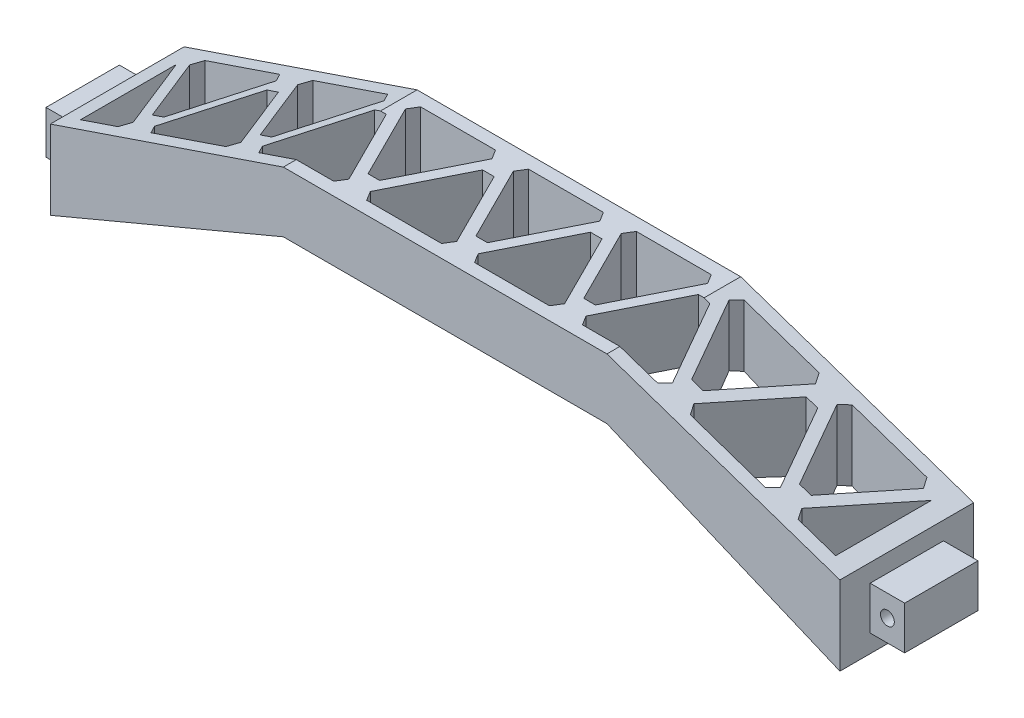
from build123d import *

# Parameters (mm, degrees)
BOSS_EXTRUDE1_DEPTH = 36
CUT_EXTRUDE2_DEPTH  = 100.565305202
BOSS_EXTRUDE4_DEPTH = 31
SKETCH15_W          = 17
SKETCH15_H          = 10
BOSS_EXTRUDE7_DEPTH = 8
SKETCH16_W          = 17
SKETCH16_H          = 10
BOSS_EXTRUDE8_DEPTH = 8
CUT_EXTRUDE7_REACH  = 110.172
SKETCH17_R          = 1.6


with BuildPart() as part:
    # Sketch1 → Boss-Extrude1 (new body)
    with BuildSketch(Plane(origin=(0, 0, 0), x_dir=(1, 0, 0), z_dir=(0, 1, 0))):
        Polygon((87.5, -12.5), (76.397542486, -12.5), (87.5, 9.704915028), (87.5, 15.5), (-87.5, 15.5), (-87.5, 9.704915028), (-76.397542486, -12.5), (-87.5, -12.5), (-87.5, -15.5), (87.5, -15.5), align=None)
        Polygon((-62.5, 9.704915028), (-51.397542486, -12.5), (-73.602457514, -12.5), align=None, mode=Mode.SUBTRACT)
        Polygon((-37.5, 9.704915028), (-26.397542486, -12.5), (-48.602457514, -12.5), align=None, mode=Mode.SUBTRACT)
        Polygon((-1.397542486, -12.5), (-23.602457514, -12.5), (-12.5, 9.704915028), align=None, mode=Mode.SUBTRACT)
        Polygon((23.602457514, -12.5), (1.397542486, -12.5), (12.5, 9.704915028), align=None, mode=Mode.SUBTRACT)
        Polygon((73.602457514, -12.5), (51.397542486, -12.5), (62.5, 9.704915028), align=None, mode=Mode.SUBTRACT)
        Polygon((-86.102457514, 12.5), (-63.897542486, 12.5), (-75, -9.704915028), align=None, mode=Mode.SUBTRACT)
        Polygon((-61.102457514, 12.5), (-38.897542486, 12.5), (-50, -9.704915028), align=None, mode=Mode.SUBTRACT)
        Polygon((-25, -9.704915028), (-36.102457514, 12.5), (-13.897542486, 12.5), align=None, mode=Mode.SUBTRACT)
        Polygon((-11.102457514, 12.5), (11.102457514, 12.5), (0, -9.704915028), align=None, mode=Mode.SUBTRACT)
        Polygon((48.602457514, -12.5), (26.397542486, -12.5), (37.5, 9.704915028), align=None, mode=Mode.SUBTRACT)
        Polygon((13.897542486, 12.5), (36.102457514, 12.5), (25, -9.704915028), align=None, mode=Mode.SUBTRACT)
        Polygon((38.897542486, 12.5), (61.102457514, 12.5), (50, -9.704915028), align=None, mode=Mode.SUBTRACT)
        Polygon((63.897542486, 12.5), (86.102457514, 12.5), (75, -9.704915028), align=None, mode=Mode.SUBTRACT)
    extrude(amount=BOSS_EXTRUDE1_DEPTH)

    # Sketch8 → Cut-Extrude2 (cut, through all)
    with BuildSketch(Plane.XY.offset(15.5)):
        Polygon((-37.5, 21), (-87.5, 0), (87.5, 0), (37.5, 21), align=None)
        Polygon((-87.5, 36), (-87.5, 18), (-37.5, 35), (37.5, 35), (87.5, 18), (87.5, 36), align=None)
    extrude(amount=-CUT_EXTRUDE2_DEPTH, mode=Mode.SUBTRACT)

    # Chamfer4
    # the kernel refuses this chamfer: 1.5 mm, written as the material it adds along each edge
    with BuildSketch(Plane(origin=(-62.5, 2.931728692, -9.704915028), x_dir=(-0.4629989892930077, 0, 0.8863588076584185), z_dir=(0, 1, 0))) as chamfer4_piece_1_section:
        with BuildLine():
            Line((3.027308523, 0), (1.729391988, 2.484713313))
            Line((1.729391988, 2.484713313), (1.70507667, 2.502285032))
            ThreePointArc((1.70507667, 2.502285032), (0.862128958, 1.244211752), (-0.024315318, 0.017571719))
            Line((-0.024315318, 0.017571719), (0.000531815, -0.029995286))
            ThreePointArc((0.000531815, -0.029995286), (1.513710407, -0.003166687), (3.027840338, -0.029995286))
            Line((3.027840338, -0.029995286), (3.027308523, 0))
        make_face()
    chamfer4_piece_1 = extrude(amount=31.136542616, mode=Mode.PRIVATE)
    chamfer4_piece_1 = split(chamfer4_piece_1, bisect_by=Plane(origin=(-59.645483248, 11.698897036, -7.924858459), z_dir=(-0.38723248435509167, 0.9219821056073614, 0)), keep=Keep.TOP, mode=Mode.PRIVATE)
    chamfer4_piece_1 = split(chamfer4_piece_1, bisect_by=Plane(origin=(-64.939848928, 25.670451364, -7.924858459), z_dir=(0.3219027332387023, -0.9467727448197127, 0)), keep=Keep.TOP, mode=Mode.PRIVATE)
    add(chamfer4_piece_1)
    with BuildSketch(Plane(origin=(-73.602457514, -0.310843565, 12.5), x_dir=(0.428553455737718, 0, -0.903516427949852), z_dir=(0, 1, 0))) as chamfer4_piece_2_section:
        with BuildLine():
            Line((2.459124564, 0), (1.0075247, -2.243253797))
            Line((1.0075247, -2.243253797), (0.980419208, -2.256110401))
            ThreePointArc((0.980419208, -2.256110401), (0.499714167, -1.123547022), (-0.027105493, -0.012856604))
            Line((-0.027105493, -0.012856604), (0.000622649, 0.029993538))
            ThreePointArc((0.000622649, 0.029993538), (1.229655274, 0.004479511), (2.459747213, 0.029993538))
            Line((2.459747213, 0.029993538), (2.459124564, 0))
        make_face()
    chamfer4_piece_2 = extrude(amount=29.18381942, mode=Mode.PRIVATE)
    chamfer4_piece_2 = split(chamfer4_piece_2, bisect_by=Plane(origin=(-69.441653139, 7.584505682, 11.78052019), z_dir=(-0.38723248435509167, 0.9219821056073614, 0)), keep=Keep.TOP, mode=Mode.PRIVATE)
    chamfer4_piece_2 = split(chamfer4_piece_2, bisect_by=Plane(origin=(-74.99909614, 22.250307312, 11.78052019), z_dir=(0.3219027332387023, -0.9467727448197127, 0)), keep=Keep.TOP, mode=Mode.PRIVATE)
    add(chamfer4_piece_2)
    with BuildSketch(Plane(origin=(-25, 21, 9.704915028), x_dir=(-0.4629989892930077, 0, -0.8863588076584186), z_dir=(0, 1, 0)), Plane(origin=(12.5, 21, -9.704915028), x_dir=(0.4629989892930091, 0, 0.8863588076584178), z_dir=(0, 1, 0)), Plane(origin=(0, 21, 9.704915028), x_dir=(-0.462998989293008, 0, -0.8863588076584183), z_dir=(0, 1, 0))) as chamfer4_piece_3:
        with BuildLine():
            Line((3.027308523, 0), (1.729391988, -2.484713313))
            Line((1.729391988, -2.484713313), (1.70507667, -2.502285032))
            ThreePointArc((1.70507667, -2.502285032), (0.862128958, -1.244211752), (-0.024315318, -0.017571719))
            Line((-0.024315318, -0.017571719), (0.000531815, 0.029995286))
            ThreePointArc((0.000531815, 0.029995286), (1.513710407, 0.003166687), (3.027840338, 0.029995286))
            Line((3.027840338, 0.029995286), (3.027308523, 0))
        make_face()
    extrude(amount=14)
    with BuildSketch(Plane(origin=(-13.897542486, 21, -12.5), x_dir=(-0.9997845924778608, 0, -0.02075496672793586), z_dir=(0, 1, 0)), Plane(origin=(23.602457514, 21, 12.5), x_dir=(-0.4285534557377203, 0, -0.9035164279498509), z_dir=(0, 1, 0)), Plane(origin=(-11.102457514, 21, -12.5), x_dir=(0.42855345573771825, 0, 0.9035164279498517), z_dir=(0, 1, 0))) as chamfer4_piece_4:
        with BuildLine():
            Line((2.459124564, 0), (1.0075247, 2.243253797))
            Line((1.0075247, 2.243253797), (0.980419208, 2.256110401))
            ThreePointArc((0.980419208, 2.256110401), (0.499714167, 1.123547022), (-0.027105493, 0.012856604))
            Line((-0.027105493, 0.012856604), (0.000622649, -0.029993538))
            ThreePointArc((0.000622649, -0.029993538), (1.229655274, -0.004479511), (2.459747213, -0.029993538))
            Line((2.459747213, -0.029993538), (2.459124564, 0))
        make_face()
    extrude(amount=14)
    with BuildSketch(Plane(origin=(-50, 8.181728692, 9.704915028), x_dir=(-0.46299898929300837, 0, -0.8863588076584181), z_dir=(0, 1, 0))) as chamfer4_piece_5_section:
        with BuildLine():
            Line((3.027308523, 0), (1.729391988, -2.484713313))
            Line((1.729391988, -2.484713313), (1.70507667, -2.502285032))
            ThreePointArc((1.70507667, -2.502285032), (0.862128958, -1.244211752), (-0.024315318, -0.017571719))
            Line((-0.024315318, -0.017571719), (0.000531815, 0.029995286))
            ThreePointArc((0.000531815, 0.029995286), (1.513710407, 0.003166687), (3.027840338, 0.029995286))
            Line((3.027840338, 0.029995286), (3.027308523, 0))
        make_face()
    chamfer4_piece_5 = extrude(amount=30.136542616, mode=Mode.PRIVATE)
    chamfer4_piece_5 = split(chamfer4_piece_5, bisect_by=Plane(origin=(-47.324104267, 16.873876208, 7.924858459), z_dir=(-0.38723248435509167, 0.9219821056073614, 0)), keep=Keep.TOP, mode=Mode.PRIVATE)
    chamfer4_piece_5 = split(chamfer4_piece_5, bisect_by=Plane(origin=(-52.287577831, 29.972223537, 7.924858459), z_dir=(0.3219027332387023, -0.9467727448197127, 0)), keep=Keep.TOP, mode=Mode.PRIVATE)
    add(chamfer4_piece_5)
    with BuildSketch(Plane(origin=(-38.897542486, 14.265220746, -12.5), x_dir=(-0.428553455737718, 0, 0.903516427949852), z_dir=(0, 1, 0))) as chamfer4_piece_6_section:
        with BuildLine():
            Line((2.459124564, 0), (1.0075247, -2.243253797))
            Line((1.0075247, -2.243253797), (0.980419208, -2.256110401))
            ThreePointArc((0.980419208, -2.256110401), (0.499714167, -1.123547022), (-0.027105493, -0.012856604))
            Line((-0.027105493, -0.012856604), (0.000622649, 0.029993538))
            ThreePointArc((0.000622649, 0.029993538), (1.229655274, 0.004479511), (2.459747213, 0.029993538))
            Line((2.459747213, 0.029993538), (2.459124564, 0))
        make_face()
    chamfer4_piece_6 = extrude(amount=26.407426218, mode=Mode.PRIVATE)
    chamfer4_piece_6 = split(chamfer4_piece_6, bisect_by=Plane(origin=(-37.52721047, 20.988571603, -11.780796898), z_dir=(-0.38723248435509167, 0.9219821056073614, 0)), keep=Keep.TOP, mode=Mode.PRIVATE)
    chamfer4_piece_6 = split(chamfer4_piece_6, bisect_by=Plane(origin=(-42.227587272, 33.392620327, -11.780796898), z_dir=(0.3219027332387023, -0.9467727448197127, 0)), keep=Keep.TOP, mode=Mode.PRIVATE)
    add(chamfer4_piece_6)
    with BuildSketch(Plane(origin=(73.602457514, -0.310843565, 12.5), x_dir=(-0.9997845924778608, 0, 0.02075496672793586), z_dir=(0, 1, 0))) as chamfer4_piece_7_section:
        with BuildLine():
            Line((2.459124564, 0), (1.0075247, -2.243253797))
            Line((1.0075247, -2.243253797), (0.980419208, -2.256110401))
            ThreePointArc((0.980419208, -2.256110401), (0.499714167, -1.123547022), (-0.027105493, -0.012856604))
            Line((-0.027105493, -0.012856604), (0.000622649, 0.029993538))
            ThreePointArc((0.000622649, 0.029993538), (1.229655274, 0.004479511), (2.459747213, 0.029993538))
            Line((2.459747213, 0.029993538), (2.459124564, 0))
        make_face()
    chamfer4_piece_7 = extrude(amount=29.18381942, mode=Mode.PRIVATE)
    chamfer4_piece_7 = split(chamfer4_piece_7, bisect_by=Plane(origin=(69.441653139, 7.584505682, 11.78052019), z_dir=(0.38723248435509167, 0.9219821056073614, 0)), keep=Keep.TOP, mode=Mode.PRIVATE)
    chamfer4_piece_7 = split(chamfer4_piece_7, bisect_by=Plane(origin=(74.99909614, 22.250307312, 11.78052019), z_dir=(-0.3219027332387023, -0.9467727448197127, 0)), keep=Keep.TOP, mode=Mode.PRIVATE)
    add(chamfer4_piece_7)
    with BuildSketch(Plane(origin=(62.5, 2.931728692, -9.704915028), x_dir=(-0.46299898929301003, 0, 0.8863588076584172), z_dir=(0, 1, 0))) as chamfer4_piece_8_section:
        with BuildLine():
            Line((3.027308523, 0), (1.729391988, 2.484713313))
            Line((1.729391988, 2.484713313), (1.70507667, 2.502285032))
            ThreePointArc((1.70507667, 2.502285032), (0.862128958, 1.244211752), (-0.024315318, 0.017571719))
            Line((-0.024315318, 0.017571719), (0.000531815, -0.029995286))
            ThreePointArc((0.000531815, -0.029995286), (1.513710407, -0.003166687), (3.027840338, -0.029995286))
            Line((3.027840338, -0.029995286), (3.027308523, 0))
        make_face()
    chamfer4_piece_8 = extrude(amount=31.136542616, mode=Mode.PRIVATE)
    chamfer4_piece_8 = split(chamfer4_piece_8, bisect_by=Plane(origin=(59.645483248, 11.698897036, -7.924858459), z_dir=(0.38723248435509167, 0.9219821056073614, 0)), keep=Keep.TOP, mode=Mode.PRIVATE)
    chamfer4_piece_8 = split(chamfer4_piece_8, bisect_by=Plane(origin=(64.939848928, 25.670451364, -7.924858459), z_dir=(-0.3219027332387023, -0.9467727448197127, 0)), keep=Keep.TOP, mode=Mode.PRIVATE)
    add(chamfer4_piece_8)
    with BuildSketch(Plane(origin=(48.602457514, 10.189156435, 12.5), x_dir=(-0.9997845924778608, 0, 0.02075496672793586), z_dir=(0, 1, 0))) as chamfer4_piece_9_section:
        with BuildLine():
            Line((2.459124564, 0), (1.0075247, -2.243253797))
            Line((1.0075247, -2.243253797), (0.980419208, -2.256110401))
            ThreePointArc((0.980419208, -2.256110401), (0.499714167, -1.123547022), (-0.027105493, -0.012856604))
            Line((-0.027105493, -0.012856604), (0.000622649, 0.029993538))
            ThreePointArc((0.000622649, 0.029993538), (1.229655274, 0.004479511), (2.459747213, 0.029993538))
            Line((2.459747213, 0.029993538), (2.459124564, 0))
        make_face()
    chamfer4_piece_9 = extrude(amount=27.18381942, mode=Mode.PRIVATE)
    chamfer4_piece_9 = split(chamfer4_piece_9, bisect_by=Plane(origin=(44.798841535, 17.934486555, 11.78050305), z_dir=(0.38723248435509167, 0.9219821056073614, 0)), keep=Keep.TOP, mode=Mode.PRIVATE)
    chamfer4_piece_9 = split(chamfer4_piece_9, bisect_by=Plane(origin=(49.694498865, 30.853870386, 11.78050305), z_dir=(-0.3219027332387023, -0.9467727448197127, 0)), keep=Keep.TOP, mode=Mode.PRIVATE)
    add(chamfer4_piece_9)
    with BuildSketch(Plane(origin=(37.5, 13.431728692, -9.704915028), x_dir=(-0.46299898929300864, 0, 0.886358807658418), z_dir=(0, 1, 0))) as chamfer4_piece_10_section:
        with BuildLine():
            Line((3.027308523, 0), (1.729391988, 2.484713313))
            Line((1.729391988, 2.484713313), (1.70507667, 2.502285032))
            ThreePointArc((1.70507667, 2.502285032), (0.862128958, 1.244211752), (-0.024315318, 0.017571719))
            Line((-0.024315318, 0.017571719), (0.000531815, -0.029995286))
            ThreePointArc((0.000531815, -0.029995286), (1.513710407, -0.003166687), (3.027840338, -0.029995286))
            Line((3.027840338, -0.029995286), (3.027308523, 0))
        make_face()
    chamfer4_piece_10 = extrude(amount=21.568271308, mode=Mode.PRIVATE)
    chamfer4_piece_10 = split(chamfer4_piece_10, bisect_by=Plane(origin=(38.21159426, 21, -7.691631439), z_dir=(0, -1, 0)), keep=Keep.TOP, mode=Mode.PRIVATE)
    chamfer4_piece_10 = split(chamfer4_piece_10, bisect_by=Plane(origin=(38.158242837, 20.723538008, -7.691631439), z_dir=(0.38723248435509167, 0.9219821056073614, 0)), keep=Keep.TOP, mode=Mode.PRIVATE)
    add(chamfer4_piece_10)
    with BuildSketch(Plane(origin=(37.5, 21, -9.704915028), x_dir=(-0.4629989892930089, 0, 0.886358807658418), z_dir=(0, 1, 0))) as chamfer4_piece_11_section:
        with BuildLine():
            Line((3.027308523, 0), (1.729391988, 2.484713313))
            Line((1.729391988, 2.484713313), (1.70507667, 2.502285032))
            ThreePointArc((1.70507667, 2.502285032), (0.862128958, 1.244211752), (-0.024315318, 0.017571719))
            Line((-0.024315318, 0.017571719), (0.000531815, -0.029995286))
            ThreePointArc((0.000531815, -0.029995286), (1.513710407, -0.003166687), (3.027840338, -0.029995286))
            Line((3.027840338, -0.029995286), (3.027308523, 0))
        make_face()
    chamfer4_piece_11 = extrude(amount=14, mode=Mode.PRIVATE)
    chamfer4_piece_11 = split(chamfer4_piece_11, bisect_by=Plane(origin=(36.841757163, 21.276461992, -7.691631439), z_dir=(-0.38723248435509167, -0.9219821056073614, 0)), keep=Keep.TOP, mode=Mode.PRIVATE)
    add(chamfer4_piece_11)
    with BuildSketch(Plane(origin=(37.5, 21, -9.704915028), x_dir=(-0.4629989892930089, 0, 0.886358807658418), z_dir=(0, 1, 0))) as chamfer4_piece_12_section:
        with BuildLine():
            Line((3.027308523, 0), (1.729391988, 2.484713313))
            Line((1.729391988, 2.484713313), (1.70507667, 2.502285032))
            ThreePointArc((1.70507667, 2.502285032), (0.862128958, 1.244211752), (-0.024315318, 0.017571719))
            Line((-0.024315318, 0.017571719), (0.000531815, -0.029995286))
            ThreePointArc((0.000531815, -0.029995286), (1.513710407, -0.003166687), (3.027840338, -0.029995286))
            Line((3.027840338, -0.029995286), (3.027308523, 0))
        make_face()
    chamfer4_piece_12 = extrude(amount=14, mode=Mode.PRIVATE)
    chamfer4_piece_12 = split(chamfer4_piece_12, bisect_by=Plane(origin=(34.998395382, 22.05067394, -7.927883797), z_dir=(0.38723248435509167, 0.9219821056073614, 0)), keep=Keep.TOP, mode=Mode.PRIVATE)
    chamfer4_piece_12 = split(chamfer4_piece_12, bisect_by=Plane(origin=(39.631451626, 34.275306447, -7.927883797), z_dir=(-0.3219027332387023, -0.9467727448197127, 0)), keep=Keep.TOP, mode=Mode.PRIVATE)
    add(chamfer4_piece_12)
    with BuildSketch(Plane(origin=(-1.397542486, 21, 12.5), x_dir=(-0.9997845924778608, 0, 0.02075496672793731), z_dir=(0, 1, 0)), Plane(origin=(-26.397542486, 21, 12.5), x_dir=(-0.999784592477861, 0, 0.020754966727934417), z_dir=(0, 1, 0)), Plane(origin=(36.102457514, 21, -12.5), x_dir=(-0.42855345573771875, 0, 0.9035164279498514), z_dir=(0, 1, 0)), Plane(origin=(11.102457514, 21, -12.5), x_dir=(-0.4285534557377206, 0, 0.9035164279498505), z_dir=(0, 1, 0)), Plane(origin=(-36.102457514, 21, -12.5), x_dir=(0.9997845924778608, 0, -0.02075496672793586), z_dir=(0, 1, 0)), Plane(origin=(26.397542486, 21, 12.5), x_dir=(0.4285534557377188, 0, -0.9035164279498513), z_dir=(0, 1, 0)), Plane(origin=(1.397542486, 21, 12.5), x_dir=(0.4285534557377207, 0, -0.9035164279498505), z_dir=(0, 1, 0)), Plane(origin=(-23.602457514, 21, 12.5), x_dir=(0.42855345573772036, 0, -0.9035164279498508), z_dir=(0, 1, 0)), Plane(origin=(13.897542486, 21, -12.5), x_dir=(0.9997845924778608, 0, -0.02075496672793586), z_dir=(0, 1, 0))) as chamfer4_piece_13:
        with BuildLine():
            Line((2.459124564, 0), (1.0075247, -2.243253797))
            Line((1.0075247, -2.243253797), (0.980419208, -2.256110401))
            ThreePointArc((0.980419208, -2.256110401), (0.499714167, -1.123547022), (-0.027105493, -0.012856604))
            Line((-0.027105493, -0.012856604), (0.000622649, 0.029993538))
            ThreePointArc((0.000622649, 0.029993538), (1.229655274, 0.004479511), (2.459747213, 0.029993538))
            Line((2.459747213, 0.029993538), (2.459124564, 0))
        make_face()
    extrude(amount=14)
    with BuildSketch(Plane(origin=(-12.5, 21, -9.704915028), x_dir=(-0.4629989892930082, 0, 0.8863588076584183), z_dir=(0, 1, 0)), Plane(origin=(25, 21, 9.704915028), x_dir=(0.4629989892930075, 0, -0.8863588076584187), z_dir=(0, 1, 0))) as chamfer4_piece_14:
        with BuildLine():
            Line((3.027308523, 0), (1.729391988, 2.484713313))
            Line((1.729391988, 2.484713313), (1.70507667, 2.502285032))
            ThreePointArc((1.70507667, 2.502285032), (0.862128958, 1.244211752), (-0.024315318, 0.017571719))
            Line((-0.024315318, 0.017571719), (0.000531815, -0.029995286))
            ThreePointArc((0.000531815, -0.029995286), (1.513710407, -0.003166687), (3.027840338, -0.029995286))
            Line((3.027840338, -0.029995286), (3.027308523, 0))
        make_face()
    extrude(amount=14)
    with BuildSketch(Plane(origin=(-37.5, 21, -9.704915028), x_dir=(-0.4629989892930091, 0, 0.8863588076584178), z_dir=(0, 1, 0))) as chamfer4_piece_15_section:
        with BuildLine():
            Line((3.027308523, 0), (1.729391988, 2.484713313))
            Line((1.729391988, 2.484713313), (1.70507667, 2.502285032))
            ThreePointArc((1.70507667, 2.502285032), (0.862128958, 1.244211752), (-0.024315318, 0.017571719))
            Line((-0.024315318, 0.017571719), (0.000531815, -0.029995286))
            ThreePointArc((0.000531815, -0.029995286), (1.513710407, -0.003166687), (3.027840338, -0.029995286))
            Line((3.027840338, -0.029995286), (3.027308523, 0))
        make_face()
    chamfer4_piece_15 = extrude(amount=14, mode=Mode.PRIVATE)
    chamfer4_piece_15 = split(chamfer4_piece_15, bisect_by=Plane(origin=(-36.841757163, 21.276461992, -7.691631439), z_dir=(0.38723248435509167, -0.9219821056073614, 0)), keep=Keep.TOP, mode=Mode.PRIVATE)
    add(chamfer4_piece_15)
    with BuildSketch(Plane(origin=(-37.5, 13.431728692, -9.704915028), x_dir=(-0.4629989892930091, 0, 0.8863588076584178), z_dir=(0, 1, 0))) as chamfer4_piece_16_section:
        with BuildLine():
            Line((3.027308523, 0), (1.729391988, 2.484713313))
            Line((1.729391988, 2.484713313), (1.70507667, 2.502285032))
            ThreePointArc((1.70507667, 2.502285032), (0.862128958, 1.244211752), (-0.024315318, 0.017571719))
            Line((-0.024315318, 0.017571719), (0.000531815, -0.029995286))
            ThreePointArc((0.000531815, -0.029995286), (1.513710407, -0.003166687), (3.027840338, -0.029995286))
            Line((3.027840338, -0.029995286), (3.027308523, 0))
        make_face()
    chamfer4_piece_16 = extrude(amount=21.568271308, mode=Mode.PRIVATE)
    chamfer4_piece_16 = split(chamfer4_piece_16, bisect_by=Plane(origin=(-38.158242837, 20.723538008, -7.691631439), z_dir=(-0.38723248435509167, 0.9219821056073614, 0)), keep=Keep.TOP, mode=Mode.PRIVATE)
    chamfer4_piece_16 = split(chamfer4_piece_16, bisect_by=Plane(origin=(-38.21159426, 21, -7.691631439), z_dir=(0, -1, 0)), keep=Keep.TOP, mode=Mode.PRIVATE)
    add(chamfer4_piece_16)
    with BuildSketch(Plane(origin=(-37.5, 21, -9.704915028), x_dir=(-0.4629989892930091, 0, 0.8863588076584178), z_dir=(0, 1, 0))) as chamfer4_piece_17_section:
        with BuildLine():
            Line((3.027308523, 0), (1.729391988, 2.484713313))
            Line((1.729391988, 2.484713313), (1.70507667, 2.502285032))
            ThreePointArc((1.70507667, 2.502285032), (0.862128958, 1.244211752), (-0.024315318, 0.017571719))
            Line((-0.024315318, 0.017571719), (0.000531815, -0.029995286))
            ThreePointArc((0.000531815, -0.029995286), (1.513710407, -0.003166687), (3.027840338, -0.029995286))
            Line((3.027840338, -0.029995286), (3.027308523, 0))
        make_face()
    chamfer4_piece_17 = extrude(amount=14, mode=Mode.PRIVATE)
    chamfer4_piece_17 = split(chamfer4_piece_17, bisect_by=Plane(origin=(-34.998395382, 22.05067394, -7.927883797), z_dir=(-0.38723248435509167, 0.9219821056073614, 0)), keep=Keep.TOP, mode=Mode.PRIVATE)
    chamfer4_piece_17 = split(chamfer4_piece_17, bisect_by=Plane(origin=(-39.631451626, 34.275306447, -7.927883797), z_dir=(0.3219027332387023, -0.9467727448197127, 0)), keep=Keep.TOP, mode=Mode.PRIVATE)
    add(chamfer4_piece_17)
    with BuildSketch(Plane(origin=(75, -2.318271308, 9.704915028), x_dir=(0.46299898929300726, 0, -0.8863588076584187), z_dir=(0, 1, 0))) as chamfer4_piece_18_section:
        with BuildLine():
            Line((3.027308523, 0), (1.729391988, 2.484713313))
            Line((1.729391988, 2.484713313), (1.70507667, 2.502285032))
            ThreePointArc((1.70507667, 2.502285032), (0.862128958, 1.244211752), (-0.024315318, 0.017571719))
            Line((-0.024315318, 0.017571719), (0.000531815, -0.029995286))
            ThreePointArc((0.000531815, -0.029995286), (1.513710407, -0.003166687), (3.027840338, -0.029995286))
            Line((3.027840338, -0.029995286), (3.027308523, 0))
        make_face()
    chamfer4_piece_18 = extrude(amount=32.136542616, mode=Mode.PRIVATE)
    chamfer4_piece_18 = split(chamfer4_piece_18, bisect_by=Plane(origin=(71.966875207, 6.523912413, 7.924858459), z_dir=(0.38723248435509167, 0.9219821056073614, 0)), keep=Keep.TOP, mode=Mode.PRIVATE)
    chamfer4_piece_18 = split(chamfer4_piece_18, bisect_by=Plane(origin=(77.592133351, 21.368674661, 7.924858459), z_dir=(-0.3219027332387023, -0.9467727448197127, 0)), keep=Keep.TOP, mode=Mode.PRIVATE)
    add(chamfer4_piece_18)
    with BuildSketch(Plane(origin=(86.102457514, -5.560843565, -12.5), x_dir=(-0.42855345573771825, 0, 0.9035164279498517), z_dir=(0, 1, 0))) as chamfer4_piece_19_section:
        with BuildLine():
            Line((2.459124564, 0), (1.0075247, -2.243253797))
            Line((1.0075247, -2.243253797), (0.980419208, -2.256110401))
            ThreePointArc((0.980419208, -2.256110401), (0.499714167, -1.123547022), (-0.027105493, -0.012856604))
            Line((-0.027105493, -0.012856604), (0.000622649, 0.029993538))
            ThreePointArc((0.000622649, 0.029993538), (1.229655274, 0.004479511), (2.459747213, 0.029993538))
            Line((2.459747213, 0.029993538), (2.459124564, 0))
        make_face()
    chamfer4_piece_19 = extrude(amount=30.18381942, mode=Mode.PRIVATE)
    chamfer4_piece_19 = split(chamfer4_piece_19, bisect_by=Plane(origin=(81.763073015, 2.409509334, -11.780527316), z_dir=(0.38723248435509167, 0.9219821056073614, 0)), keep=Keep.TOP, mode=Mode.PRIVATE)
    chamfer4_piece_19 = split(chamfer4_piece_19, bisect_by=Plane(origin=(87.65140923, 17.948520862, -11.780527316), z_dir=(-0.3219027332387023, -0.9467727448197127, 0)), keep=Keep.TOP, mode=Mode.PRIVATE)
    add(chamfer4_piece_19)
    with BuildSketch(Plane(origin=(50, 8.181728692, 9.704915028), x_dir=(0.46299898929300953, 0, -0.8863588076584177), z_dir=(0, 1, 0))) as chamfer4_piece_20_section:
        with BuildLine():
            Line((3.027308523, 0), (1.729391988, 2.484713313))
            Line((1.729391988, 2.484713313), (1.70507667, 2.502285032))
            ThreePointArc((1.70507667, 2.502285032), (0.862128958, 1.244211752), (-0.024315318, 0.017571719))
            Line((-0.024315318, 0.017571719), (0.000531815, -0.029995286))
            ThreePointArc((0.000531815, -0.029995286), (1.513710407, -0.003166687), (3.027840338, -0.029995286))
            Line((3.027840338, -0.029995286), (3.027308523, 0))
        make_face()
    chamfer4_piece_20 = extrude(amount=30.136542616, mode=Mode.PRIVATE)
    chamfer4_piece_20 = split(chamfer4_piece_20, bisect_by=Plane(origin=(47.324104267, 16.873876208, 7.924858459), z_dir=(0.38723248435509167, 0.9219821056073614, 0)), keep=Keep.TOP, mode=Mode.PRIVATE)
    chamfer4_piece_20 = split(chamfer4_piece_20, bisect_by=Plane(origin=(52.287577831, 29.972223537, 7.924858459), z_dir=(-0.3219027332387023, -0.9467727448197127, 0)), keep=Keep.TOP, mode=Mode.PRIVATE)
    add(chamfer4_piece_20)
    with BuildSketch(Plane(origin=(61.102457514, 4.939156435, -12.5), x_dir=(-0.42855345573772, 0, 0.9035164279498509), z_dir=(0, 1, 0))) as chamfer4_piece_21_section:
        with BuildLine():
            Line((2.459124564, 0), (1.0075247, -2.243253797))
            Line((1.0075247, -2.243253797), (0.980419208, -2.256110401))
            ThreePointArc((0.980419208, -2.256110401), (0.499714167, -1.123547022), (-0.027105493, -0.012856604))
            Line((-0.027105493, -0.012856604), (0.000622649, 0.029993538))
            ThreePointArc((0.000622649, 0.029993538), (1.229655274, 0.004479511), (2.459747213, 0.029993538))
            Line((2.459747213, 0.029993538), (2.459124564, 0))
        make_face()
    chamfer4_piece_21 = extrude(amount=28.18381942, mode=Mode.PRIVATE)
    chamfer4_piece_21 = split(chamfer4_piece_21, bisect_by=Plane(origin=(57.120242051, 12.759498339, -11.780512163), z_dir=(0.38723248435509167, 0.9219821056073614, 0)), keep=Keep.TOP, mode=Mode.PRIVATE)
    chamfer4_piece_21 = split(chamfer4_piece_21, bisect_by=Plane(origin=(62.346792075, 26.552090695, -11.780512163), z_dir=(-0.3219027332387023, -0.9467727448197127, 0)), keep=Keep.TOP, mode=Mode.PRIVATE)
    add(chamfer4_piece_21)
    with BuildSketch(Plane(origin=(-75, -2.318271308, 9.704915028), x_dir=(-0.46299898929301, 0, -0.8863588076584172), z_dir=(0, 1, 0))) as chamfer4_piece_22_section:
        with BuildLine():
            Line((3.027308523, 0), (1.729391988, -2.484713313))
            Line((1.729391988, -2.484713313), (1.70507667, -2.502285032))
            ThreePointArc((1.70507667, -2.502285032), (0.862128958, -1.244211752), (-0.024315318, -0.017571719))
            Line((-0.024315318, -0.017571719), (0.000531815, 0.029995286))
            ThreePointArc((0.000531815, 0.029995286), (1.513710407, 0.003166687), (3.027840338, 0.029995286))
            Line((3.027840338, 0.029995286), (3.027308523, 0))
        make_face()
    chamfer4_piece_22 = extrude(amount=32.136542616, mode=Mode.PRIVATE)
    chamfer4_piece_22 = split(chamfer4_piece_22, bisect_by=Plane(origin=(-71.966875207, 6.523912413, 7.924858459), z_dir=(-0.38723248435509167, 0.9219821056073614, 0)), keep=Keep.TOP, mode=Mode.PRIVATE)
    chamfer4_piece_22 = split(chamfer4_piece_22, bisect_by=Plane(origin=(-77.592133351, 21.368674661, 7.924858459), z_dir=(0.3219027332387023, -0.9467727448197127, 0)), keep=Keep.TOP, mode=Mode.PRIVATE)
    add(chamfer4_piece_22)
    with BuildSketch(Plane(origin=(-63.897542486, 3.765220746, -12.5), x_dir=(-0.428553455737718, 0, 0.903516427949852), z_dir=(0, 1, 0))) as chamfer4_piece_23_section:
        with BuildLine():
            Line((2.459124564, 0), (1.0075247, -2.243253797))
            Line((1.0075247, -2.243253797), (0.980419208, -2.256110401))
            ThreePointArc((0.980419208, -2.256110401), (0.499714167, -1.123547022), (-0.027105493, -0.012856604))
            Line((-0.027105493, -0.012856604), (0.000622649, 0.029993538))
            ThreePointArc((0.000622649, 0.029993538), (1.229655274, 0.004479511), (2.459747213, 0.029993538))
            Line((2.459747213, 0.029993538), (2.459124564, 0))
        make_face()
    chamfer4_piece_23 = extrude(amount=28.407426218, mode=Mode.PRIVATE)
    chamfer4_piece_23 = split(chamfer4_piece_23, bisect_by=Plane(origin=(-62.170008803, 10.638596303, -11.780778396), z_dir=(-0.38723248435509167, 0.9219821056073614, 0)), keep=Keep.TOP, mode=Mode.PRIVATE)
    chamfer4_piece_23 = split(chamfer4_piece_23, bisect_by=Plane(origin=(-67.53217092, 24.789061887, -11.780778396), z_dir=(0.3219027332387023, -0.9467727448197127, 0)), keep=Keep.TOP, mode=Mode.PRIVATE)
    add(chamfer4_piece_23)
    with BuildSketch(Plane(origin=(-61.102457514, 4.939156435, -12.5), x_dir=(0.4285534557377177, 0, 0.903516427949852), z_dir=(0, 1, 0))) as chamfer4_piece_24_section:
        with BuildLine():
            Line((2.459124564, 0), (1.0075247, 2.243253797))
            Line((1.0075247, 2.243253797), (0.980419208, 2.256110401))
            ThreePointArc((0.980419208, 2.256110401), (0.499714167, 1.123547022), (-0.027105493, 0.012856604))
            Line((-0.027105493, 0.012856604), (0.000622649, -0.029993538))
            ThreePointArc((0.000622649, -0.029993538), (1.229655274, -0.004479511), (2.459747213, -0.029993538))
            Line((2.459747213, -0.029993538), (2.459124564, 0))
        make_face()
    chamfer4_piece_24 = extrude(amount=28.18381942, mode=Mode.PRIVATE)
    chamfer4_piece_24 = split(chamfer4_piece_24, bisect_by=Plane(origin=(-57.120242051, 12.759498339, -11.780512163), z_dir=(-0.38723248435509167, 0.9219821056073614, 0)), keep=Keep.TOP, mode=Mode.PRIVATE)
    chamfer4_piece_24 = split(chamfer4_piece_24, bisect_by=Plane(origin=(-62.346792075, 26.552090695, -11.780512163), z_dir=(0.3219027332387023, -0.9467727448197127, 0)), keep=Keep.TOP, mode=Mode.PRIVATE)
    add(chamfer4_piece_24)
    with BuildSketch(Plane(origin=(-76.397542486, -1.484779254, 12.5), x_dir=(-0.9997845924778608, 0, 0.02075496672793586), z_dir=(0, 1, 0))) as chamfer4_piece_25_section:
        with BuildLine():
            Line((2.459124564, 0), (1.0075247, -2.243253797))
            Line((1.0075247, -2.243253797), (0.980419208, -2.256110401))
            ThreePointArc((0.980419208, -2.256110401), (0.499714167, -1.123547022), (-0.027105493, -0.012856604))
            Line((-0.027105493, -0.012856604), (0.000622649, 0.029993538))
            ThreePointArc((0.000622649, 0.029993538), (1.229655274, 0.004479511), (2.459747213, 0.029993538))
            Line((2.459747213, 0.029993538), (2.459124564, 0))
        make_face()
    chamfer4_piece_25 = extrude(amount=29.407426218, mode=Mode.PRIVATE)
    chamfer4_piece_25 = split(chamfer4_piece_25, bisect_by=Plane(origin=(-74.491423684, 5.463602053, 11.780770758), z_dir=(-0.38723248435509167, 0.9219821056073614, 0)), keep=Keep.TOP, mode=Mode.PRIVATE)
    chamfer4_piece_25 = split(chamfer4_piece_25, bisect_by=Plane(origin=(-80.184478881, 20.487277181, 11.780770758), z_dir=(0.3219027332387023, -0.9467727448197127, 0)), keep=Keep.TOP, mode=Mode.PRIVATE)
    add(chamfer4_piece_25)
    with BuildSketch(Plane(origin=(76.397542486, -1.484779254, 12.5), x_dir=(0.4285534557377229, 0, -0.9035164279498494), z_dir=(0, 1, 0))) as chamfer4_piece_26_section:
        with BuildLine():
            Line((2.459124564, 0), (1.0075247, -2.243253797))
            Line((1.0075247, -2.243253797), (0.980419208, -2.256110401))
            ThreePointArc((0.980419208, -2.256110401), (0.499714167, -1.123547022), (-0.027105493, -0.012856604))
            Line((-0.027105493, -0.012856604), (0.000622649, 0.029993538))
            ThreePointArc((0.000622649, 0.029993538), (1.229655274, 0.004479511), (2.459747213, 0.029993538))
            Line((2.459747213, 0.029993538), (2.459124564, 0))
        make_face()
    chamfer4_piece_26 = extrude(amount=29.407426218, mode=Mode.PRIVATE)
    chamfer4_piece_26 = split(chamfer4_piece_26, bisect_by=Plane(origin=(74.491423684, 5.463602053, 11.780770758), z_dir=(0.38723248435509167, 0.9219821056073614, 0)), keep=Keep.TOP, mode=Mode.PRIVATE)
    chamfer4_piece_26 = split(chamfer4_piece_26, bisect_by=Plane(origin=(80.184478881, 20.487277181, 11.780770758), z_dir=(-0.3219027332387023, -0.9467727448197127, 0)), keep=Keep.TOP, mode=Mode.PRIVATE)
    add(chamfer4_piece_26)
    with BuildSketch(Plane(origin=(51.397542486, 9.015220746, 12.5), x_dir=(0.4285534557377206, 0, -0.9035164279498505), z_dir=(0, 1, 0))) as chamfer4_piece_27_section:
        with BuildLine():
            Line((2.459124564, 0), (1.0075247, -2.243253797))
            Line((1.0075247, -2.243253797), (0.980419208, -2.256110401))
            ThreePointArc((0.980419208, -2.256110401), (0.499714167, -1.123547022), (-0.027105493, -0.012856604))
            Line((-0.027105493, -0.012856604), (0.000622649, 0.029993538))
            ThreePointArc((0.000622649, 0.029993538), (1.229655274, 0.004479511), (2.459747213, 0.029993538))
            Line((2.459747213, 0.029993538), (2.459124564, 0))
        make_face()
    chamfer4_piece_27 = extrude(amount=27.407426218, mode=Mode.PRIVATE)
    chamfer4_piece_27 = split(chamfer4_piece_27, bisect_by=Plane(origin=(49.848603709, 15.813586442, 11.780787039), z_dir=(0.38723248435509167, 0.9219821056073614, 0)), keep=Keep.TOP, mode=Mode.PRIVATE)
    chamfer4_piece_27 = split(chamfer4_piece_27, bisect_by=Plane(origin=(54.87987301, 29.090843177, 11.780787039), z_dir=(-0.3219027332387023, -0.9467727448197127, 0)), keep=Keep.TOP, mode=Mode.PRIVATE)
    add(chamfer4_piece_27)
    with BuildSketch(Plane(origin=(-48.602457514, 10.189156435, 12.5), x_dir=(0.42855345573772036, 0, -0.9035164279498508), z_dir=(0, 1, 0))) as chamfer4_piece_28_section:
        with BuildLine():
            Line((2.459124564, 0), (1.0075247, -2.243253797))
            Line((1.0075247, -2.243253797), (0.980419208, -2.256110401))
            ThreePointArc((0.980419208, -2.256110401), (0.499714167, -1.123547022), (-0.027105493, -0.012856604))
            Line((-0.027105493, -0.012856604), (0.000622649, 0.029993538))
            ThreePointArc((0.000622649, 0.029993538), (1.229655274, 0.004479511), (2.459747213, 0.029993538))
            Line((2.459747213, 0.029993538), (2.459124564, 0))
        make_face()
    chamfer4_piece_28 = extrude(amount=27.18381942, mode=Mode.PRIVATE)
    chamfer4_piece_28 = split(chamfer4_piece_28, bisect_by=Plane(origin=(-44.798841535, 17.934486555, 11.78050305), z_dir=(-0.38723248435509167, 0.9219821056073614, 0)), keep=Keep.TOP, mode=Mode.PRIVATE)
    chamfer4_piece_28 = split(chamfer4_piece_28, bisect_by=Plane(origin=(-49.694498865, 30.853870386, 11.78050305), z_dir=(0.3219027332387023, -0.9467727448197127, 0)), keep=Keep.TOP, mode=Mode.PRIVATE)
    add(chamfer4_piece_28)
    with BuildSketch(Plane(origin=(63.897542486, 3.765220746, -12.5), x_dir=(0.9997845924778608, 0, -0.02075496672793586), z_dir=(0, 1, 0))) as chamfer4_piece_29_section:
        with BuildLine():
            Line((2.459124564, 0), (1.0075247, -2.243253797))
            Line((1.0075247, -2.243253797), (0.980419208, -2.256110401))
            ThreePointArc((0.980419208, -2.256110401), (0.499714167, -1.123547022), (-0.027105493, -0.012856604))
            Line((-0.027105493, -0.012856604), (0.000622649, 0.029993538))
            ThreePointArc((0.000622649, 0.029993538), (1.229655274, 0.004479511), (2.459747213, 0.029993538))
            Line((2.459747213, 0.029993538), (2.459124564, 0))
        make_face()
    chamfer4_piece_29 = extrude(amount=28.407426218, mode=Mode.PRIVATE)
    chamfer4_piece_29 = split(chamfer4_piece_29, bisect_by=Plane(origin=(62.170008803, 10.638596303, -11.780778396), z_dir=(0.38723248435509167, 0.9219821056073614, 0)), keep=Keep.TOP, mode=Mode.PRIVATE)
    chamfer4_piece_29 = split(chamfer4_piece_29, bisect_by=Plane(origin=(67.53217092, 24.789061887, -11.780778396), z_dir=(-0.3219027332387023, -0.9467727448197127, 0)), keep=Keep.TOP, mode=Mode.PRIVATE)
    add(chamfer4_piece_29)
    with BuildSketch(Plane(origin=(38.897542486, 14.265220746, -12.5), x_dir=(0.9997845924778608, 0, -0.02075496672793586), z_dir=(0, 1, 0))) as chamfer4_piece_30_section:
        with BuildLine():
            Line((2.459124564, 0), (1.0075247, -2.243253797))
            Line((1.0075247, -2.243253797), (0.980419208, -2.256110401))
            ThreePointArc((0.980419208, -2.256110401), (0.499714167, -1.123547022), (-0.027105493, -0.012856604))
            Line((-0.027105493, -0.012856604), (0.000622649, 0.029993538))
            ThreePointArc((0.000622649, 0.029993538), (1.229655274, 0.004479511), (2.459747213, 0.029993538))
            Line((2.459747213, 0.029993538), (2.459124564, 0))
        make_face()
    chamfer4_piece_30 = extrude(amount=26.407426218, mode=Mode.PRIVATE)
    chamfer4_piece_30 = split(chamfer4_piece_30, bisect_by=Plane(origin=(37.52721047, 20.988571603, -11.780796898), z_dir=(0.38723248435509167, 0.9219821056073614, 0)), keep=Keep.TOP, mode=Mode.PRIVATE)
    chamfer4_piece_30 = split(chamfer4_piece_30, bisect_by=Plane(origin=(42.227587272, 33.392620327, -11.780796898), z_dir=(-0.3219027332387023, -0.9467727448197127, 0)), keep=Keep.TOP, mode=Mode.PRIVATE)
    add(chamfer4_piece_30)
    with BuildSketch(Plane(origin=(-86.102457514, -5.560843565, -12.5), x_dir=(0.42855345573771875, 0, 0.9035164279498514), z_dir=(0, 1, 0))) as chamfer4_piece_31_section:
        with BuildLine():
            Line((2.459124564, 0), (1.0075247, 2.243253797))
            Line((1.0075247, 2.243253797), (0.980419208, 2.256110401))
            ThreePointArc((0.980419208, 2.256110401), (0.499714167, 1.123547022), (-0.027105493, 0.012856604))
            Line((-0.027105493, 0.012856604), (0.000622649, -0.029993538))
            ThreePointArc((0.000622649, -0.029993538), (1.229655274, -0.004479511), (2.459747213, -0.029993538))
            Line((2.459747213, -0.029993538), (2.459124564, 0))
        make_face()
    chamfer4_piece_31 = extrude(amount=30.18381942, mode=Mode.PRIVATE)
    chamfer4_piece_31 = split(chamfer4_piece_31, bisect_by=Plane(origin=(-81.763073015, 2.409509334, -11.780527316), z_dir=(-0.38723248435509167, 0.9219821056073614, 0)), keep=Keep.TOP, mode=Mode.PRIVATE)
    chamfer4_piece_31 = split(chamfer4_piece_31, bisect_by=Plane(origin=(-87.65140923, 17.948520862, -11.780527316), z_dir=(0.3219027332387023, -0.9467727448197127, 0)), keep=Keep.TOP, mode=Mode.PRIVATE)
    add(chamfer4_piece_31)
    with BuildSketch(Plane(origin=(-51.397542486, 9.015220746, 12.5), x_dir=(-0.9997845924778608, 0, 0.02075496672793586), z_dir=(0, 1, 0))) as chamfer4_piece_32_section:
        with BuildLine():
            Line((2.459124564, 0), (1.0075247, -2.243253797))
            Line((1.0075247, -2.243253797), (0.980419208, -2.256110401))
            ThreePointArc((0.980419208, -2.256110401), (0.499714167, -1.123547022), (-0.027105493, -0.012856604))
            Line((-0.027105493, -0.012856604), (0.000622649, 0.029993538))
            ThreePointArc((0.000622649, 0.029993538), (1.229655274, 0.004479511), (2.459747213, 0.029993538))
            Line((2.459747213, 0.029993538), (2.459124564, 0))
        make_face()
    chamfer4_piece_32 = extrude(amount=27.407426218, mode=Mode.PRIVATE)
    chamfer4_piece_32 = split(chamfer4_piece_32, bisect_by=Plane(origin=(-49.848603709, 15.813586442, 11.780787039), z_dir=(-0.38723248435509167, 0.9219821056073614, 0)), keep=Keep.TOP, mode=Mode.PRIVATE)
    chamfer4_piece_32 = split(chamfer4_piece_32, bisect_by=Plane(origin=(-54.87987301, 29.090843177, 11.780787039), z_dir=(0.3219027332387023, -0.9467727448197127, 0)), keep=Keep.TOP, mode=Mode.PRIVATE)
    add(chamfer4_piece_32)

    # Sketch10 → Boss-Extrude4 (add)
    with BuildSketch(Plane.XY.offset(15.5)):
        Polygon((91.5, -1.68), (87.5, 0), (87.5, 18), (91.5, 16.64), align=None)
        Polygon((-91.5, 16.64), (-91.5, -1.68), (-87.5, 0), (-87.5, 18), align=None)
    extrude(amount=-BOSS_EXTRUDE4_DEPTH)

    # Sketch15 → Boss-Extrude7 (add)
    with BuildSketch(Plane(origin=(91.5, 0, 0), x_dir=(0, 0, -1), z_dir=(1, 0, 0))):
        with Locations((0, 7.48)):
            Rectangle(SKETCH15_W, SKETCH15_H)
    extrude(amount=BOSS_EXTRUDE7_DEPTH)

    # Sketch16 → Boss-Extrude8 (add)
    with BuildSketch(Plane.ZY.offset(91.5)):
        with Locations((0, 7.48)):
            Rectangle(SKETCH16_W, SKETCH16_H)
    extrude(amount=BOSS_EXTRUDE8_DEPTH)

    # Sketch17 → Cut-Extrude7 (cut, up to next)
    with BuildSketch(Plane.XY.offset(8.5), mode=Mode.PRIVATE) as cut_extrude7_sk1:
        with Locations((-95.5, 7.48)):
            Circle(SKETCH17_R)
    cut_extrude7_tool1 = extrude(cut_extrude7_sk1.sketch, amount=-CUT_EXTRUDE7_REACH, mode=Mode.PRIVATE) & part.part
    # Sketch17 → Cut-Extrude7 (cut, up to next)
    with BuildSketch(Plane.XY.offset(8.5), mode=Mode.PRIVATE) as cut_extrude7_sk2:
        with Locations((95.5, 7.48)):
            Circle(SKETCH17_R)
    cut_extrude7_tool2 = extrude(cut_extrude7_sk2.sketch, amount=-CUT_EXTRUDE7_REACH, mode=Mode.PRIVATE) & part.part
    add(cut_extrude7_tool1.solids().sort_by_distance((-95.5, 7.48, 8.5))[0], mode=Mode.SUBTRACT)
    add(cut_extrude7_tool2.solids().sort_by_distance((95.5, 7.48, 8.5))[0], mode=Mode.SUBTRACT)


solid = part.part
